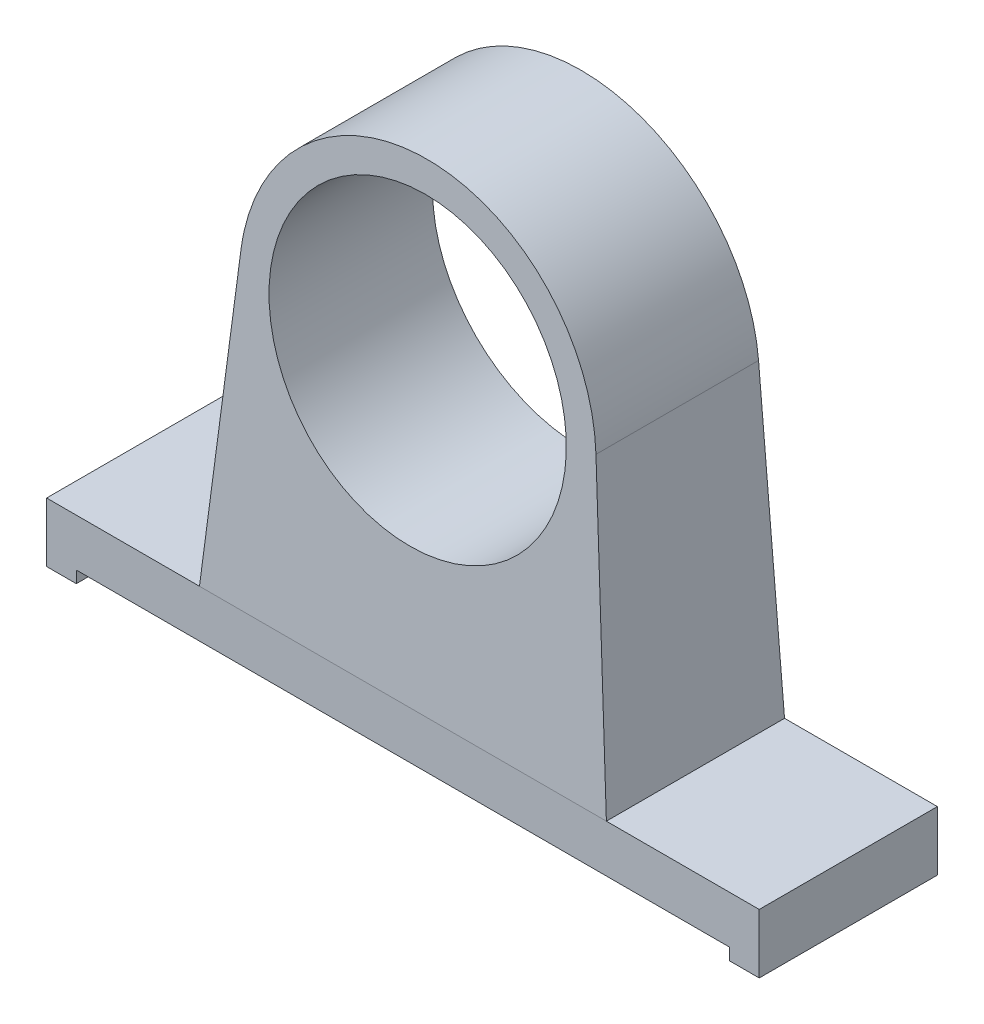
from build123d import *

# Parameters (mm, degrees)
SKETCH1_W                       = 60
SKETCH1_H                       = 15
BOSS_EXTRUDE1_DEPTH             = 5
BOSS_EXTRUDE2_REACH             = 33.325
SKETCH2_R                       = 12.5
BOSS_EXTRUDE2_DIRECTION_2_REACH = 33.325
SKETCH3_W                       = 55
SKETCH3_H                       = 2
CUT_EXTRUDE1_DEPTH              = 56.082201073
DRAFT1_START                    = 7.751401292
DRAFT1_DEPTH                    = 3.248598708


with BuildPart() as part:
    # Sketch1 → Boss-Extrude1 (new body)
    with BuildSketch(Plane(origin=(0, 0, 0), x_dir=(1, 0, 0), z_dir=(0, 1, 0))):
        Rectangle(SKETCH1_W, SKETCH1_H)
    extrude(amount=BOSS_EXTRUDE1_DEPTH)

    # Boss-Extrude2: up to this face of the body (flat: up to its plane)
    boss_extrude2_end = Plane(part.part.faces().sort_by_distance((0, 2.5, 7.5))[0])
    # Sketch2 → Boss-Extrude2 (add, up to the picked face)
    with BuildSketch(Plane.XY, mode=Mode.PRIVATE) as boss_extrude2_sk1:
        with BuildLine():
            Line((-17.13013706, 5), (-14.942920471, 30))
            ThreePointArc((-14.942920471, 30), (0, 43.692663859), (14.942920471, 30))
            Line((14.942920471, 30), (17.13013706, 5))
            Line((17.13013706, 5), (-17.13013706, 5))
        make_face()
        with Locations(Location((0, 28.692663859, 0), (0, 0, 180))):
            Circle(SKETCH2_R, mode=Mode.SUBTRACT)
    boss_extrude2_tool1 = split(extrude(boss_extrude2_sk1.sketch, amount=BOSS_EXTRUDE2_REACH, mode=Mode.PRIVATE), bisect_by=boss_extrude2_end, keep=Keep.BOTH, mode=Mode.PRIVATE)
    add(boss_extrude2_tool1.solids().sort_by(Axis((15.521689, 17.454957, 0), (0, 0, 1)))[0])

    # Boss-Extrude2 direction 2: up to this face of the body (flat: up to its plane)
    boss_extrude2_direction_2_end = Plane(part.part.faces().sort_by_distance((0, 2.5, -7.5))[0])
    # Sketch2 → Boss-Extrude2 direction 2 (add, up to the picked face)
    with BuildSketch(Plane.XY, mode=Mode.PRIVATE) as boss_extrude2_direction_2_sk1:
        with BuildLine():
            Line((-17.13013706, 5), (-14.942920471, 30))
            ThreePointArc((-14.942920471, 30), (0, 43.692663859), (14.942920471, 30))
            Line((14.942920471, 30), (17.13013706, 5))
            Line((17.13013706, 5), (-17.13013706, 5))
        make_face()
        with Locations(Location((0, 28.692663859, 0), (0, 0, 180))):
            Circle(SKETCH2_R, mode=Mode.SUBTRACT)
    boss_extrude2_direction_2_tool1 = split(extrude(boss_extrude2_direction_2_sk1.sketch, amount=-BOSS_EXTRUDE2_DIRECTION_2_REACH, mode=Mode.PRIVATE), bisect_by=boss_extrude2_direction_2_end, keep=Keep.BOTH, mode=Mode.PRIVATE)
    add(boss_extrude2_direction_2_tool1.solids().sort_by(Axis((15.521689, 17.454957, 0), (0, 0, -1)))[0])

    # Sketch3 → Cut-Extrude1 (cut, through all)
    with BuildSketch(Plane.XY.offset(7.5)):
        Rectangle(SKETCH3_W, SKETCH3_H)
    extrude(amount=-CUT_EXTRUDE1_DEPTH, mode=Mode.SUBTRACT)

    # Draft1: read off the stored shape, not the designer's step
    # Draft1 outline → Draft1 (cut)
    with BuildSketch(Plane(origin=(0, 0, 0), x_dir=(1, 0, 0), z_dir=(0, 0.05233595624294388, 0.9986295347545738)).offset(DRAFT1_START)):
        with BuildLine():
            add(Edge.make_bspline(
                [(14.942920471, 29.634936652), (13.74496761, 43.346391583), (0, 43.346391583), (-13.74496761, 43.346391583), (-14.942920471, 29.634936652)],
                knots=[4.799655443, 4.799655443, 4.799655443, 6.283185307, 6.283185307, 7.766715171, 7.766715171, 7.766715171], degree=2, weights=[1, 0.737277337, 1, 0.737277337, 1]))
            Line((-14.942920471, 29.634936652), (-17.13013706, 4.600628002))
            Line((-17.13013706, 4.600628002), (17.13013706, 4.600628002))
            Line((17.13013706, 4.600628002), (14.942920471, 29.634936652))
        make_face()
    extrude(amount=DRAFT1_DEPTH, mode=Mode.SUBTRACT)


solid = part.part
